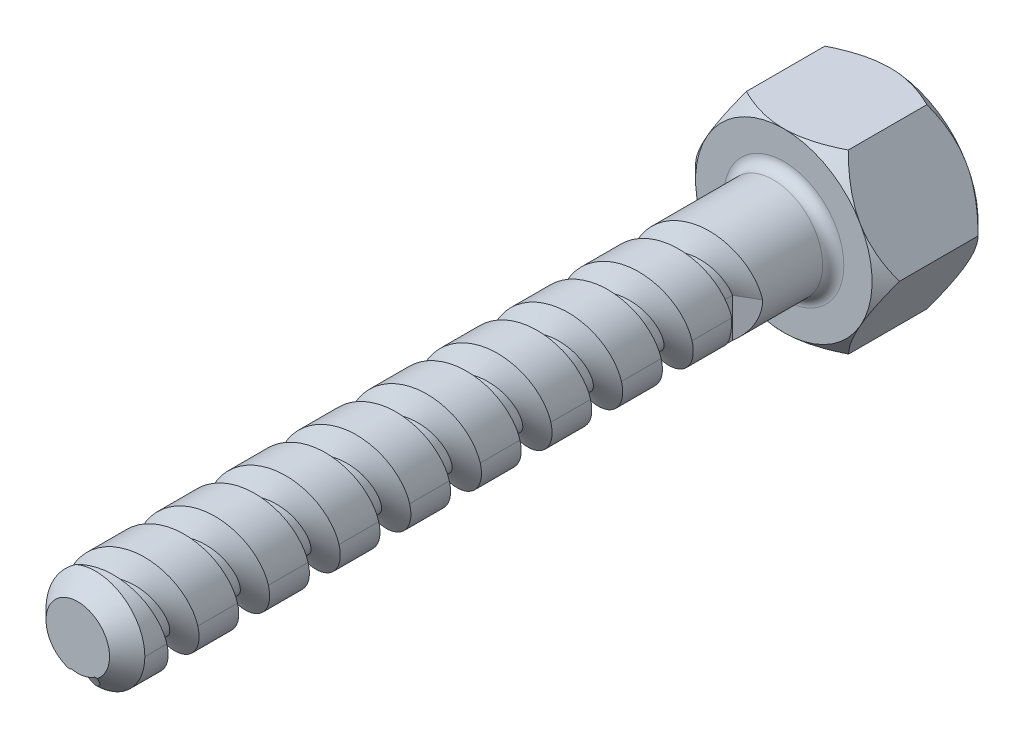
from build123d import *

# Parameters (mm, degrees)
BOSS_EXTRUDE1_DEPTH     = 1.5
SKETCH2_OUTSIDE_W       = 21.132
SKETCH2_OUTSIDE_H       = 20.364
SKETCH2_OUTSIDE_R       = 2.5
CUT_EXTRUDE1_DEPTH      = 5.857941385
CUT_EXTRUDE1_DRAFT      = -45
MIRROR1_COPY_1_SKETCH_W = 21.132
MIRROR1_COPY_1_SKETCH_H = 20.364
MIRROR1_COPY_1_SKETCH_R = 2.5
MIRROR1_COPY_1_DEPTH    = 5.857941385
MIRROR1_COPY_1_DRAFT    = -45
SKETCH3_R               = 1.4
BOSS_EXTRUDE2_DEPTH     = 20
CHAMFER1_SIZE           = 0.5
THREAD1_PITCH           = 2
CUT_EXTRUDE2_DEPTH      = 22.836886197
FILLET1_R               = 0.3
SCALE1_SCALE            = 0.8


with BuildPart() as part:
    # Sketch1 → Boss-Extrude1 (new, symmetric)
    with BuildSketch(Plane.XY):
        Polygon((-1.437716774, -2.503258638), (1.449027186, -2.496728569), (2.88674396, 0.006530069), (1.437716774, 2.503258638), (-1.449027186, 2.496728569), (-2.88674396, -0.006530069), align=None)
    extrude(amount=BOSS_EXTRUDE1_DEPTH, both=True)


with BuildPart() as cut_extrude1_tool:
    # Sketch2 outside → Cut-Extrude1 (with draft: the straight prism first)
    with BuildSketch(Plane.XY.offset(1.5)):
        Rectangle(SKETCH2_OUTSIDE_W, SKETCH2_OUTSIDE_H)
        Circle(SKETCH2_OUTSIDE_R, mode=Mode.SUBTRACT)
    extrude(amount=-CUT_EXTRUDE1_DEPTH)
    # Cut-Extrude1: the draft: its side faces are tilted about the plane it starts from
    cut_extrude1_sides = [cut_extrude1_tool.faces().sort_by_distance(p)[0] for p in [
        (0, -10.182, -1.428970693),
        (10.566, 0, -1.428970693),
        (0, 10.182, -1.428970693),
        (-10.566, 0, -1.428970693),
        (-2.5, 0, -1.428970693),
    ]]
    draft(cut_extrude1_sides, Plane.XY.offset(1.5), CUT_EXTRUDE1_DRAFT)


with BuildPart() as part_1:
    add(part.part)

    # Cut-Extrude1: cut by cut_extrude1_tool
    add(cut_extrude1_tool.part, mode=Mode.SUBTRACT)


with BuildPart() as mirror1_copy_1_tool:
    # Mirror1 copy 1 sketch → Mirror1 copy 1 (with draft: the straight prism first)
    with BuildSketch(Plane(origin=(0, 0, -1.5), x_dir=(1, 0, 0), z_dir=(0, 0, -1))):
        Rectangle(MIRROR1_COPY_1_SKETCH_W, MIRROR1_COPY_1_SKETCH_H)
        Circle(MIRROR1_COPY_1_SKETCH_R, mode=Mode.SUBTRACT)
    extrude(amount=-MIRROR1_COPY_1_DEPTH)
    # Mirror1 copy 1: the draft: its side faces are tilted about the plane it starts from
    mirror1_copy_1_sides = [mirror1_copy_1_tool.faces().sort_by_distance(p)[0] for p in [
        (0, -10.182, 1.428970693),
        (10.566, 0, 1.428970693),
        (0, 10.182, 1.428970693),
        (-10.566, 0, 1.428970693),
        (-2.5, 0, 1.428970693),
    ]]
    draft(mirror1_copy_1_sides, Plane(origin=(0, 0, -1.5), x_dir=(1, 0, 0), z_dir=(0, 0, -1)), MIRROR1_COPY_1_DRAFT)


with BuildPart() as part_2:
    add(part_1.part)

    # Mirror1 copy 1: cut by mirror1_copy_1_tool
    add(mirror1_copy_1_tool.part, mode=Mode.SUBTRACT)

    # Sketch3 → Boss-Extrude2 (add)
    with BuildSketch(Plane.XY.offset(1.5)):
        Circle(SKETCH3_R)
    extrude(amount=BOSS_EXTRUDE2_DEPTH)

    # Chamfer1
    chamfer1_edges = [part_2.edges().sort_by_distance(p)[0] for p in [
        (-1.4, 0, 21.5),
    ]]
    chamfer(chamfer1_edges, length=CHAMFER1_SIZE)

    # Thread1: the profile of Thread Profile2 profile screwed along a right-hand helix of 9 turns, 10 arcs to a turn; built about Z, then put on its axis
    thread1_z = Axis((0, 0, 0), (0, 0, 1))
    thread1_corners = [(1.4003, 0, -0.000173205), (1.4003, 0, 0.875173202), (0.858734125, 0, 0.562499999), (0.858734125, 0, 0.312499999)]
    with BuildLine(mode=Mode.PRIVATE) as thread1_profile:
        Line(thread1_corners[0], thread1_corners[1])
        Line(thread1_corners[1], thread1_corners[2])
        Line(thread1_corners[2], thread1_corners[3])
        Line(thread1_corners[3], thread1_corners[0])
    thread1_cap = Face(thread1_profile.wire())
    thread1_turn_angles = [0, 18, 36, 54, 72, 90, 108, 126, 144, 162, 180, 198, 216, 234, 252, 270, 288, 306, 324, 342, 360]
    thread1_turn_weights = [1, 0.9510565162951535, 1, 0.9510565162951535, 1, 0.9510565162951535, 1, 0.9510565162951535, 1, 0.9510565162951535, 1, 0.9510565162951535, 1, 0.9510565162951535, 1, 0.9510565162951535, 1, 0.9510565162951535, 1, 0.9510565162951535, 1]
    thread1_turn_rails = [Edge.make_bspline([Vector(p[0], p[1], 0).rotate(thread1_z, thread1_turn_angles[k]) / thread1_turn_weights[k] + Vector(0, 0, p[2] + THREAD1_PITCH * thread1_turn_angles[k] / 360) for k in range(21)], [0, 0, 0, 1, 1, 2, 2, 3, 3, 4, 4, 5, 5, 6, 6, 7, 7, 8, 8, 9, 9, 10, 10, 10], 2, thread1_turn_weights) for p in thread1_corners]
    thread1_turn_sides = [Face.make_surface_from_curves(thread1_turn_rails[p[0]], thread1_turn_rails[p[1]]) for p in [(0, 1), (1, 2), (2, 3), (3, 0)]]
    thread1 = Plane(origin=(0, 0, 3.5), x_dir=(1, 0, 0), z_dir=(0, 0, 1)) * Solid(Shell([*[p.moved(Location((0, 0, THREAD1_PITCH * i))) for i in range(9) for p in thread1_turn_sides], thread1_cap, thread1_cap.rotate(thread1_z, 3240).moved(Location((0, 0, THREAD1_PITCH * 3240 / 360)))]))
    add(thread1, mode=Mode.SUBTRACT)

    # Sketch14 → Cut-Extrude2 (cut, through all)
    with BuildSketch(Plane(origin=(0, 0, 0), x_dir=(1, 0, 0), z_dir=(0, 1, 0))):
        Polygon((1.4, -3.5), (0.858734125, -3.812499999), (0.858734125, -4.062499999), (1.4, -4.374999997), align=None)
    extrude(amount=-CUT_EXTRUDE2_DEPTH, mode=Mode.SUBTRACT)

    # Fillet1
    fillet1_edges = [part_2.edges().sort_by_distance(p)[0] for p in [
        (-1.4, 0, 1.5),
    ]]
    fillet(fillet1_edges, radius=FILLET1_R)


with BuildPart() as part_3:
    # Scale1: scaled about (0.000187281, -0.003403749, 6.880151474)
    add(part_2.part.scale(SCALE1_SCALE).moved(Location((3.7456e-05, -0.00068075, 1.376030295))))


solid = part_3.part
